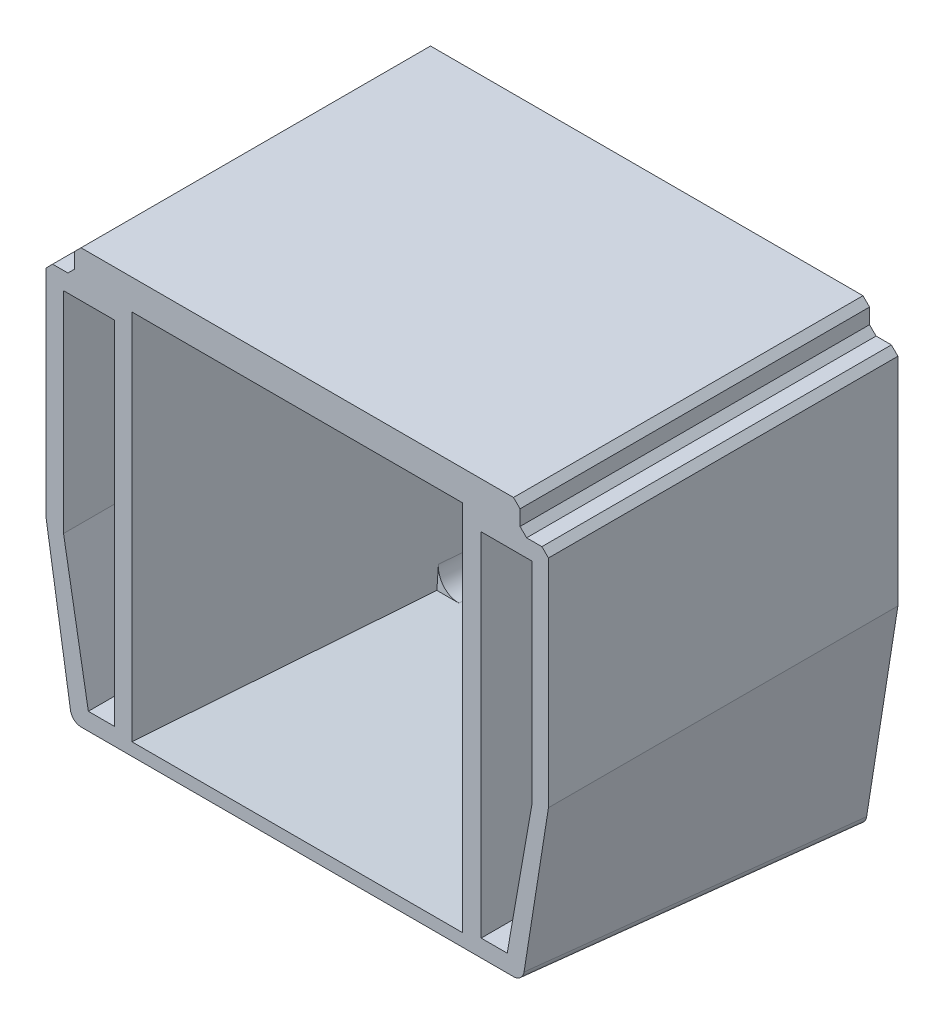
from build123d import *

# Parameters (mm, degrees)
BOSS_EXTRUDE1_DEPTH     = 160
CUT_EXTRUDE1_DEPTH      = 305.764548692
CUT_EXTRUDE1_DEPTH_BACK = 305.764548692
BOSS_EXTRUDE2_DEPTH     = 20
SKETCH5_W               = 151.467001677
SKETCH5_H               = 170
CUT_EXTRUDE2_DEPTH      = 180
FILLET1_START           = -7.935101665
FILLET1_DEPTH           = 20.924834967
FILLET1_START_2         = 12.989733302
FILLET1_2_DEPTH         = 11.975549634
SKETCH6_R               = 5
SKETCH6_R_2             = 3.25
CUT_EXTRUDE3_DEPTH      = 180
CUT_EXTRUDE4_DEPTH      = 150
FILLET2_R               = 5


with BuildPart() as part:
    # Sketch1 → Boss-Extrude1 (new body)
    with BuildSketch(Plane.XY):
        Polygon((-67.312693498, 90.077399381), (130.687306502, 90.077399381), (133.687306502, 87.077399381), (133.687306502, 80.077399381), (136.687306502, 77.077399381), (143.687306502, 77.077399381), (146.687306502, 74.077399381), (146.687306502, -24.922600619), (131.687306502, -119.922600619), (-68.312693498, -119.922600619), (-83.312693498, -24.922600619), (-83.312693498, 74.077399381), (-80.312693498, 77.077399381), (-73.312693498, 77.077399381), (-70.312693498, 80.077399381), (-70.312693498, 87.077399381), align=None)
    extrude(amount=BOSS_EXTRUDE1_DEPTH)

    # Sketch4 → Cut-Extrude1 (cut, two sides: drawn at the far end of the back side and taken through both)
    with BuildSketch(Plane(origin=(146.687306502, 0, 0), x_dir=(0, 0, -1), z_dir=(1, 0, 0)).offset(-CUT_EXTRUDE1_DEPTH_BACK)):
        Polygon((533.86053197, -186.655167115), (0, -119.922600619), (-160, -99.922600619), (-693.86053197, -33.190034123), (-827.325664962, -1100.911098062), (400.395398977, -1254.376231054), align=None)
    extrude(amount=CUT_EXTRUDE1_DEPTH + CUT_EXTRUDE1_DEPTH_BACK, mode=Mode.SUBTRACT)

    # 3DSketch1 → Boss-Extrude2 (add, along a direction that is not the sketch's normal)
    with BuildSketch(Plane(origin=(-55.046194337, -112.922600619, 0), x_dir=(0.6840030395475861, 0.727675877553092, -0.05126069758597554), z_dir=(0, 0.07027027027027033, 0.9975279891392237))):
        Polygon((0, 0), (118.651956408, -126.540562316), (253.60560063, 0), (134.953644222, 126.540562316), align=None)
    extrude(amount=BOSS_EXTRUDE2_DEPTH, dir=(0, 0, 1))

    # Sketch5 → Cut-Extrude2 (cut)
    with BuildSketch(Plane(origin=(0, -0.557601739, -7.915486008), x_dir=(-1, 0, 0), z_dir=(0, -0.07027027027027048, -0.9975279891392237))):
        with Locations((-31.687306502, -20.143454724)):
            Rectangle(SKETCH5_W, SKETCH5_H)
    extrude(amount=-CUT_EXTRUDE2_DEPTH, mode=Mode.SUBTRACT)

    # Fillet1: read off the stored shape, not the designer's step
    # Fillet1 outline → Fillet1 (add)
    with BuildSketch(Plane(origin=(0, 0, 0), x_dir=(1, 0, 0), z_dir=(0, 0.07027027027027048, 0.9975279891392238)).offset(FILLET1_START)):
        with BuildLine():
            ThreePointArc((107.42080734, -95.143454724), (104.491875152, -102.214522536), (97.42080734, -105.143454724))
            Line((97.42080734, -105.143454724), (107.42080734, -105.143454724))
            Line((107.42080734, -105.143454724), (107.42080734, -95.143454724))
        make_face()
        with BuildLine():
            Line((-44.046194337, -105.143454724), (-34.046194337, -105.143454724))
            ThreePointArc((-34.046194337, -105.143454724), (-41.117262149, -102.214522536), (-44.046194337, -95.143454724))
            Line((-44.046194337, -95.143454724), (-44.046194337, -105.143454724))
        make_face()
        with BuildLine():
            ThreePointArc((97.42080734, 64.856545276), (104.491875152, 61.927613088), (107.42080734, 54.856545276))
            Line((107.42080734, 54.856545276), (107.42080734, 64.856545276))
            Line((107.42080734, 64.856545276), (97.42080734, 64.856545276))
        make_face()
        with BuildLine():
            Line((-44.046194337, 64.856545276), (-44.046194337, 54.856545276))
            ThreePointArc((-44.046194337, 54.856545276), (-41.117262149, 61.927613088), (-34.046194337, 64.856545276))
            Line((-34.046194337, 64.856545276), (-44.046194337, 64.856545276))
        make_face()
    extrude(amount=FILLET1_DEPTH)

    # Fillet1 2 outline → Fillet1 2 (add)
    with BuildSketch(Plane(origin=(0, 0, 0), x_dir=(1, 0, 0), z_dir=(0, 0.07027027027027048, 0.9975279891392238)).offset(FILLET1_START_2)):
        with BuildLine():
            ThreePointArc((97.42080734, 64.856545276), (104.491875152, 61.927613088), (107.42080734, 54.856545276))
            Line((107.42080734, 54.856545276), (107.42080734, 64.856545276))
            Line((107.42080734, 64.856545276), (97.42080734, 64.856545276))
        make_face()
        with BuildLine():
            Line((-44.046194337, 64.856545276), (-44.046194337, 54.856545276))
            ThreePointArc((-44.046194337, 54.856545276), (-41.117262149, 61.927613088), (-34.046194337, 64.856545276))
            Line((-34.046194337, 64.856545276), (-44.046194337, 64.856545276))
        make_face()
    extrude(amount=FILLET1_2_DEPTH)

    # Sketch6 → Cut-Extrude3 (cut)
    with BuildSketch(Plane(origin=(0, 0, 0), x_dir=(-1, 0, 0), z_dir=(0, 0, -1))):
        with Locations((-129.687306502, 57.077399381)):
            Circle(SKETCH6_R)
        with Locations((-129.687306502, 10.077399381)):
            Circle(SKETCH6_R)
        with Locations((66.312693498, 57.077399381)):
            Circle(SKETCH6_R)
        with Locations((66.312693498, 10.077399381)):
            Circle(SKETCH6_R_2)
        with Locations((66.312693498, -12.922600619)):
            Circle(SKETCH6_R)
    extrude(amount=-CUT_EXTRUDE3_DEPTH, mode=Mode.SUBTRACT)

    # Sketch7 → Cut-Extrude4 (cut)
    with BuildSketch(Plane.XY.offset(160)):
        Polygon((-75.312693498, 69.077399381), (-52.046194337, 69.077399381), (-52.046194337, -25.922600619), (-52.046194337, -92.030689236), (-63.956851508, -92.030689236), (-75.312693498, -27.22448539), align=None)
        Polygon((139.154308179, 69.077399381), (115.887809017, 69.077399381), (115.887809017, -25.922600619), (115.887809017, -92.030689236), (127.798466188, -92.030689236), (139.154308179, -27.22448539), align=None)
    extrude(amount=-CUT_EXTRUDE4_DEPTH, mode=Mode.SUBTRACT)

    # Fillet2
    fillet2_edges = [part.edges().sort_by_distance(p)[0] for p in [
        (-69.891640867, -109.922600619, 80),
        (133.26625387, -109.922600619, 80),
    ]]
    fillet(fillet2_edges, radius=FILLET2_R)


solid = part.part
